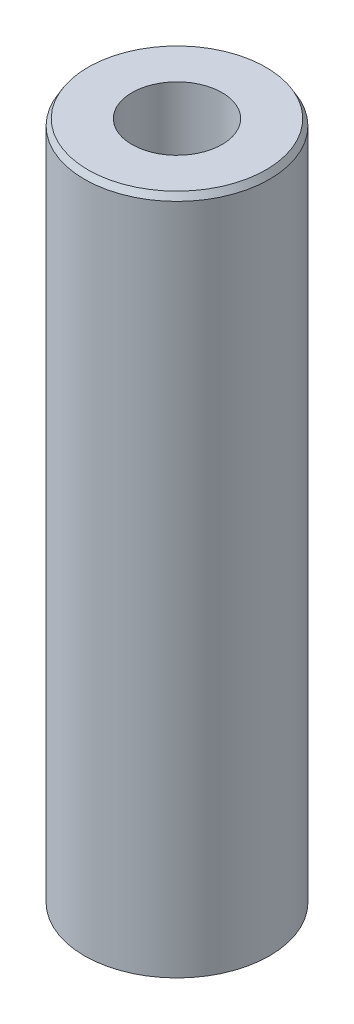
from build123d import *
from OCP.BRepFilletAPI import BRepFilletAPI_MakeChamfer

# Parameters (mm, degrees)
SKETCH1_R           = 10
BOSS_EXTRUDE1_DEPTH = 73.715517829
SKETCH2_R           = 4.863707785
CUT_EXTRUDE1_DEPTH  = 76.059826597
CHAMFER1_SIZE       = 0.680160824
CHAMFER1_SIZE2      = 0.392691035


with BuildPart() as part:
    # Sketch1 → Boss-Extrude1 (new body)
    with BuildSketch(Plane(origin=(0, 0, 0), x_dir=(1, 0, 0), z_dir=(0, 1, 0))):
        Circle(SKETCH1_R)
    extrude(amount=BOSS_EXTRUDE1_DEPTH)

    # Sketch2 → Cut-Extrude1 (cut, through all)
    with BuildSketch(Plane(origin=(0, 0, 0), x_dir=(1, 0, 0), z_dir=(0, 1, 0))):
        Circle(SKETCH2_R)
    extrude(amount=CUT_EXTRUDE1_DEPTH, mode=Mode.SUBTRACT)

    # Chamfer1: one chamfer whose edges measure the first distance from different faces: ONE call of the kernel's chamfer builder (chamfer() names one face for all edges)
    chamfer1_edges_1 = [part.edges().sort_by_distance(p)[0] for p in [
        (-10, 73.715517829, 0),
    ]]
    chamfer1_side_1 = [part.faces().sort_by_distance(p)[0] for p in [
        (-10, 36.857758914, 0),
    ]]
    chamfer1_edges_2 = [part.edges().sort_by_distance(p)[0] for p in [
        (-10, 0, 0),
    ]]
    chamfer1_side_2 = [part.faces().sort_by_distance(p)[0] for p in [
        (-9.717157288, 0, 0),
    ]]
    chamfer1 = BRepFilletAPI_MakeChamfer(part.part.solid().wrapped)
    for e in chamfer1_edges_1:
        chamfer1.Add(CHAMFER1_SIZE, CHAMFER1_SIZE2, e.wrapped, chamfer1_side_1[0].wrapped)  # the first distance lies on this face
    for e in chamfer1_edges_2:
        chamfer1.Add(CHAMFER1_SIZE, CHAMFER1_SIZE2, e.wrapped, chamfer1_side_2[0].wrapped)  # the first distance lies on this face
    add(Compound.cast(chamfer1.Shape()), mode=Mode.REPLACE)


solid = part.part
